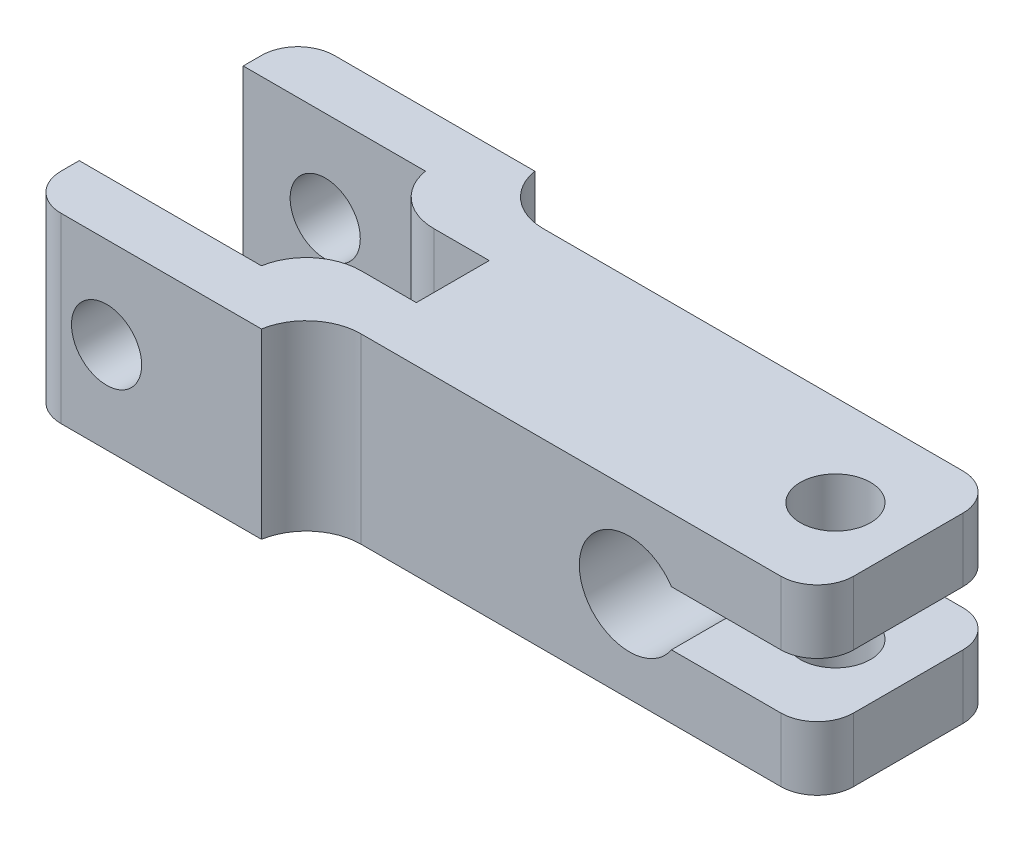
from build123d import *

# Parameters (mm, degrees)
BOSS_EXTRUDE1_DEPTH             = 10
SKETCH2_R                       = 1.925
CUT_EXTRUDE1_DEPTH              = 29.104589728
BOSS_EXTRUDE2_REACH             = 28.737
BOSS_EXTRUDE2_DIRECTION_2_REACH = 28.737
SKETCH4_R                       = 1.925
CUT_EXTRUDE2_DEPTH              = 29.980475562
FILLET1_START                   = -6
FILLET1_DEPTH                   = 12
FILLET1_START_2                 = -5
FILLET1_2_DEPTH                 = 10
FILLET2_R                       = 2


with BuildPart() as part:
    # Sketch1 → Boss-Extrude1 (new body)
    with BuildSketch(Plane.XY):
        with BuildLine():
            Line((-0.712802471, 5), (-0.712802471, 0))
            Line((-0.712802471, 0), (11.232311414, 0))
            ThreePointArc((11.232311414, 0), (13.199986934, 2.636374102), (16.287197529, 1.5))
            Line((16.287197529, 1.5), (24.287197529, 1.5))
            Line((24.287197529, 1.5), (24.287197529, 5))
            Line((24.287197529, 5), (-0.712802471, 5))
        make_face()
        with BuildLine():
            Line((11.232311414, 0), (-0.712802471, 0))
            Line((-0.712802471, 0), (-0.712802471, -5))
            Line((-0.712802471, -5), (24.287197529, -5))
            Line((24.287197529, -5), (24.287197529, -1.5))
            Line((24.287197529, -1.5), (16.287197529, -1.5))
            ThreePointArc((16.287197529, -1.5), (13.199986934, -2.636374102), (11.232311414, 0))
        make_face()
    extrude(amount=BOSS_EXTRUDE1_DEPTH)

    # Sketch2 → Cut-Extrude1 (cut, through all)
    with BuildSketch(Plane(origin=(0, 5, 0), x_dir=(1, 0, 0), z_dir=(0, 1, 0))):
        with Locations(Location((20.287197529, -5, 0), (0, 0, 270))):
            Circle(SKETCH2_R)
    extrude(amount=-CUT_EXTRUDE1_DEPTH, mode=Mode.SUBTRACT)

    # Boss-Extrude2: up to this face of the body (flat: up to its plane)
    boss_extrude2_end = Plane(part.part.faces().sort_by_distance((11.372052598, 5, 5))[0])
    # Sketch3 → Boss-Extrude2 (add, up to the picked face)
    with BuildSketch(Plane(origin=(0, 0, 0), x_dir=(1, 0, 0), z_dir=(0, 1, 0)), mode=Mode.PRIVATE) as boss_extrude2_sk1:
        Polygon((-0.712802471, 0), (-3.712802471, 0), (-3.712802471, 2.5), (-16.712802471, 2.5), (-16.712802471, -0.5), (-6.712802471, -0.5), (-6.712802471, -3), (-0.712802471, -3), align=None)
    boss_extrude2_tool1 = split(extrude(boss_extrude2_sk1.sketch, amount=BOSS_EXTRUDE2_REACH, mode=Mode.PRIVATE), bisect_by=boss_extrude2_end, keep=Keep.BOTH, mode=Mode.PRIVATE)
    # Sketch3 → Boss-Extrude2 (add, up to the picked face)
    with BuildSketch(Plane(origin=(0, 0, 0), x_dir=(1, 0, 0), z_dir=(0, 1, 0)), mode=Mode.PRIVATE) as boss_extrude2_sk2:
        Polygon((-0.712802471, -7), (-6.712802471, -7), (-6.712802471, -9.5), (-16.712802471, -9.5), (-16.712802471, -12.5), (-3.712802471, -12.5), (-3.712802471, -10), (-0.712802471, -10), align=None)
    boss_extrude2_tool2 = split(extrude(boss_extrude2_sk2.sketch, amount=BOSS_EXTRUDE2_REACH, mode=Mode.PRIVATE), bisect_by=boss_extrude2_end, keep=Keep.BOTH, mode=Mode.PRIVATE)
    add(boss_extrude2_tool1.solids().sort_by(Axis((-8.239829, 0, -0.222973), (0, 1, 0)))[0])
    add(boss_extrude2_tool2.solids().sort_by(Axis((-8.239829, 0, 10.222973), (0, 1, 0)))[0])

    # Boss-Extrude2 direction 2: up to this face of the body (flat: up to its plane)
    boss_extrude2_direction_2_end = Plane(part.part.faces().sort_by_distance((11.372052598, -5, 5))[0])
    # Sketch3 → Boss-Extrude2 direction 2 (add, up to the picked face)
    with BuildSketch(Plane(origin=(0, 0, 0), x_dir=(1, 0, 0), z_dir=(0, 1, 0)), mode=Mode.PRIVATE) as boss_extrude2_direction_2_sk1:
        Polygon((-0.712802471, 0), (-3.712802471, 0), (-3.712802471, 2.5), (-16.712802471, 2.5), (-16.712802471, -0.5), (-6.712802471, -0.5), (-6.712802471, -3), (-0.712802471, -3), align=None)
    boss_extrude2_direction_2_tool1 = split(extrude(boss_extrude2_direction_2_sk1.sketch, amount=-BOSS_EXTRUDE2_DIRECTION_2_REACH, mode=Mode.PRIVATE), bisect_by=boss_extrude2_direction_2_end, keep=Keep.BOTH, mode=Mode.PRIVATE)
    # Sketch3 → Boss-Extrude2 direction 2 (add, up to the picked face)
    with BuildSketch(Plane(origin=(0, 0, 0), x_dir=(1, 0, 0), z_dir=(0, 1, 0)), mode=Mode.PRIVATE) as boss_extrude2_direction_2_sk2:
        Polygon((-0.712802471, -7), (-6.712802471, -7), (-6.712802471, -9.5), (-16.712802471, -9.5), (-16.712802471, -12.5), (-3.712802471, -12.5), (-3.712802471, -10), (-0.712802471, -10), align=None)
    boss_extrude2_direction_2_tool2 = split(extrude(boss_extrude2_direction_2_sk2.sketch, amount=-BOSS_EXTRUDE2_DIRECTION_2_REACH, mode=Mode.PRIVATE), bisect_by=boss_extrude2_direction_2_end, keep=Keep.BOTH, mode=Mode.PRIVATE)
    add(boss_extrude2_direction_2_tool1.solids().sort_by(Axis((-8.239829, 0, -0.222973), (0, -1, 0)))[0])
    add(boss_extrude2_direction_2_tool2.solids().sort_by(Axis((-8.239829, 0, 10.222973), (0, -1, 0)))[0])

    # Sketch4 → Cut-Extrude2 (cut, through all)
    with BuildSketch(Plane.XY.offset(12.5)):
        with Locations((-12.212802471, 0)):
            Circle(SKETCH4_R)
    extrude(amount=-CUT_EXTRUDE2_DEPTH, mode=Mode.SUBTRACT)

    # Fillet1: read off the stored shape, not the designer's step
    # Fillet1 outline → Fillet1 (cut)
    with BuildSketch(Plane(origin=(0, 0, 0), x_dir=(1, 0, 0), z_dir=(0, 1, 0)).offset(FILLET1_START)):
        with BuildLine():
            Line((-6.712802471, -7), (-6.712802471, -9.5))
            ThreePointArc((-6.712802471, -9.5), (-5.691254253, -7.708712153), (-3.75476258, -7))
            Line((-3.75476258, -7), (-6.712802471, -7))
        make_face()
        with BuildLine():
            ThreePointArc((-3.75476258, -3), (-5.691254253, -2.291287847), (-6.712802471, -0.5))
            Line((-6.712802471, -0.5), (-6.712802471, -3))
            Line((-6.712802471, -3), (-3.75476258, -3))
        make_face()
    extrude(amount=FILLET1_DEPTH, mode=Mode.SUBTRACT)

    # Fillet1 2 outline → Fillet1 2 (add)
    with BuildSketch(Plane(origin=(0, 0, 0), x_dir=(1, 0, 0), z_dir=(0, 1, 0)).offset(FILLET1_START_2)):
        with BuildLine():
            Line((-3.712802471, -10), (-3.712802471, -12.5))
            ThreePointArc((-3.712802471, -12.5), (-2.691254253, -10.708712153), (-0.75476258, -10))
            Line((-0.75476258, -10), (-3.712802471, -10))
        make_face()
        with BuildLine():
            ThreePointArc((-0.75476258, 0), (-2.691254253, 0.708712153), (-3.712802471, 2.5))
            Line((-3.712802471, 2.5), (-3.712802471, 0))
            Line((-3.712802471, 0), (-0.75476258, 0))
        make_face()
    extrude(amount=FILLET1_2_DEPTH)

    # Fillet2
    fillet2_edges = [part.edges().sort_by_distance(p)[0] for p in [
        (24.287197529, 3.25, 0),
        (24.287197529, -3.25, 0),
        (24.287197529, -3.25, 10),
        (24.287197529, 3.25, 10),
        (-16.712802471, 0, -2.5),
        (-16.712802471, 0, 12.5),
    ]]
    fillet(fillet2_edges, radius=FILLET2_R)


solid = part.part
